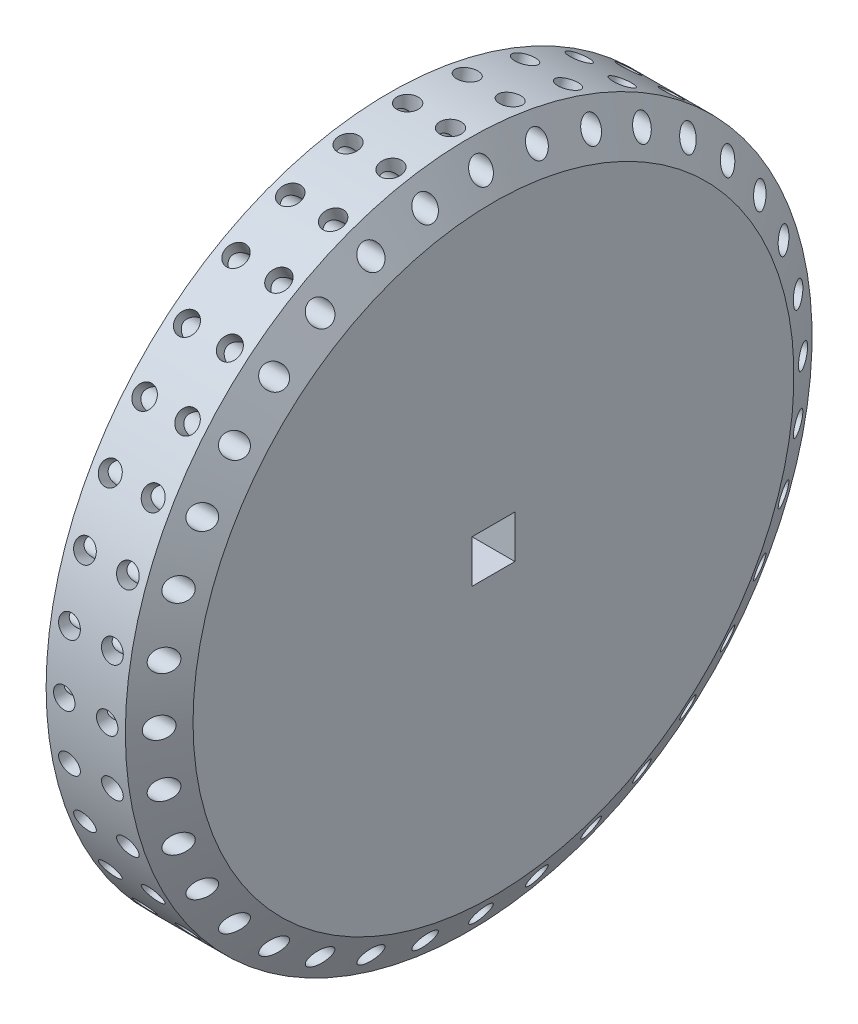
from build123d import *

# Parameters (mm, degrees)
SKETCH2_R               = 0.79375
CUT_EXTRUDE1_DEPTH      = 39.1
CUT_EXTRUDE2_REACH      = 60.199
CUT_EXTRUDE2_END_RADIUS = 0.79375
SKETCH3_R               = 0.79375
CHAMFER1_SIZE           = 3.175
CHAMFER1_SIZE_2         = 1.833087105
CHAMFER2_SIZE           = 3.175
CHAMFER2_SIZE_2         = 1.833087105
CIRPATTERN1_COUNT       = 36
CUT_EXTRUDE3_REACH      = 40.1
SKETCH4_W               = 3.175
SKETCH4_H               = 3.175
SKETCH5_W               = 6.35
SKETCH5_H               = 6.35
CUT_EXTRUDE4_DEPTH      = 5.334
SKETCH6_R               = 5.08
CUT_EXTRUDE5_DEPTH      = 1.27


with BuildPart() as part:
    # Sketch1 → Revolve1 (revolve)
    with BuildSketch(Plane.XY, mode=Mode.PRIVATE) as revolve1_sk:
        Polygon((0, 0), (0, 6.35), (3.175, 12.7), (3.175, 25.4), (12.7, 25.4), (12.7, 0), align=None)
    revolve(revolve1_sk.sketch.rotate(Axis((12.7, 0, 0), (1, 0, 0)), 90), axis=Axis((12.7, 0, 0), (1, 0, 0)))

    # Sketch2 → Cut-Extrude1 (cut, through all)
    with BuildSketch(Plane(origin=(12.7, 0, 0), x_dir=(0, 0, -1), z_dir=(1, 0, 0))):
        with Locations((0, 23.8125)):
            Circle(SKETCH2_R)
    cut_extrude1 = extrude(amount=-CUT_EXTRUDE1_DEPTH, mode=Mode.SUBTRACT)

    # Cut-Extrude2: up to this cylinder (the profile starts outside it)
    cut_extrude2_end = Plane(origin=(7.9375, 23.8125, 0), z_dir=(1, 0, 0)) * Cylinder(CUT_EXTRUDE2_END_RADIUS, 126.1605, mode=Mode.PRIVATE)
    # Sketch3 → Cut-Extrude2 (cut, up to the surface)
    with BuildSketch(Plane(origin=(0, 25.4, 0), x_dir=(1, 0, 0), z_dir=(0, 1, 0)), mode=Mode.PRIVATE) as cut_extrude2_sk1:
        with Locations(Location((9.525, 0, 0), (0, 0, 270))):
            Circle(SKETCH3_R)
    cut_extrude2_tool1 = extrude(cut_extrude2_sk1.sketch, amount=-CUT_EXTRUDE2_REACH, mode=Mode.PRIVATE) - cut_extrude2_end
    # Sketch3 → Cut-Extrude2 (cut, up to the surface)
    with BuildSketch(Plane(origin=(0, 25.4, 0), x_dir=(1, 0, 0), z_dir=(0, 1, 0)), mode=Mode.PRIVATE) as cut_extrude2_sk2:
        with Locations(Location((6.35, 0, 0), (0, 0, 270))):
            Circle(SKETCH3_R)
    cut_extrude2_tool2 = extrude(cut_extrude2_sk2.sketch, amount=-CUT_EXTRUDE2_REACH, mode=Mode.PRIVATE) - cut_extrude2_end
    cut_extrude2 = cut_extrude2_tool1.solids().sort_by_distance((9.525, 25.4, 0))[0] + cut_extrude2_tool2.solids().sort_by_distance((6.35, 25.4, 0))[0]
    add(cut_extrude2, mode=Mode.SUBTRACT)

    # Chamfer1
    # the kernel refuses this chamfer: 3.175, 1.833087105 mm, written as the material it takes off along each edge
    with BuildSketch(Plane(origin=(12.7, 0, 0), x_dir=(0, 0, 1), z_dir=(0, 1, 0))) as chamfer1_piece_1:
        Polygon((25.4 - CHAMFER1_SIZE, 0), (25.4, -CHAMFER1_SIZE_2), (25.4, 0), align=None)
    revolve(axis=Axis((12.7, 0, 0), (1, 0, 0)), mode=Mode.SUBTRACT)

    # Chamfer2
    # the kernel refuses this chamfer: 3.175, 1.833087105 mm, written as the material it takes off along each edge
    with BuildSketch(Plane(origin=(3.175, 0, 0), x_dir=(0, 0, 1), z_dir=(0, 1, 0))) as chamfer2_piece_1:
        Polygon((25.4 - CHAMFER2_SIZE, 0), (25.4, CHAMFER2_SIZE_2), (25.4, 0), align=None)
    revolve(axis=Axis((3.175, 0, 0), (1, 0, 0)), mode=Mode.SUBTRACT)

    # CirPattern1: Cut-Extrude1, Cut-Extrude2 ×36 about axis
    cirpattern1_axis = Axis((0, 0, 0), (1, 0, 0))
    add([cut_extrude1.rotate(cirpattern1_axis, i * 360 / CIRPATTERN1_COUNT) for i in range(1, CIRPATTERN1_COUNT)], mode=Mode.SUBTRACT)
    add([cut_extrude2.rotate(cirpattern1_axis, i * 360 / CIRPATTERN1_COUNT) for i in range(1, CIRPATTERN1_COUNT)], mode=Mode.SUBTRACT)

    # Sketch4 → Cut-Extrude3 (cut, up to next)
    with BuildSketch(Plane.ZY, mode=Mode.PRIVATE) as cut_extrude3_sk1:
        Rectangle(SKETCH4_W, SKETCH4_H)
    cut_extrude3_tool1 = extrude(cut_extrude3_sk1.sketch, amount=-CUT_EXTRUDE3_REACH, mode=Mode.PRIVATE) & part.part
    add(cut_extrude3_tool1.solids().sort_by_distance((0, 0, 0))[0], mode=Mode.SUBTRACT)

    # Sketch5 → Cut-Extrude4 (cut)
    with BuildSketch(Plane.ZY):
        Rectangle(SKETCH5_W, SKETCH5_H)
    extrude(amount=-CUT_EXTRUDE4_DEPTH, mode=Mode.SUBTRACT)

    # Sketch6 → Cut-Extrude5 (cut)
    with BuildSketch(Plane.ZY):
        Circle(SKETCH6_R)
    extrude(amount=-CUT_EXTRUDE5_DEPTH, mode=Mode.SUBTRACT)


solid = part.part
